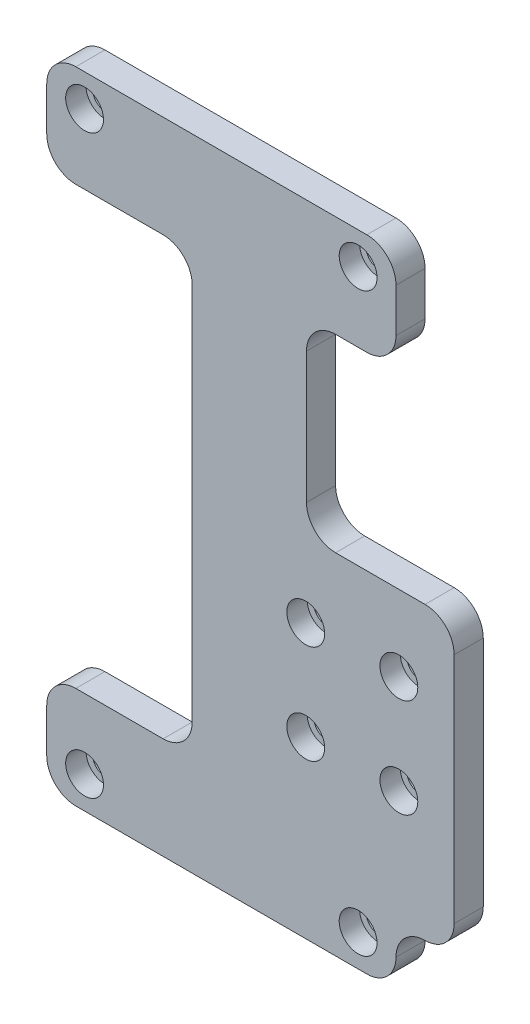
from build123d import *
from build123d.topology import SkipClean

# Parameters (mm, degrees)
BOSS_EXTRUDE1_DEPTH = 5
SKETCH3_R           = 2.1
CUT_EXTRUDE1_DEPTH  = 10
BOSS_EXTRUDE2_DEPTH = 5
SKETCH4_3_R         = 2.1
CUT_EXTRUDE2_DEPTH  = 5
FILLET1_R           = 5
SKETCH5_W           = 25
SKETCH5_H           = 75
SKETCH5_W_2         = 15.371996706
SKETCH5_H_2         = 32.5
CUT_EXTRUDE3_DEPTH  = 5
FILLET2_R           = 5
SKETCH6_R           = 3.25
CUT_EXTRUDE4_DEPTH  = 3.5


with BuildPart() as part:
    # Sketch1 → Boss-Extrude1 (new body)
    with BuildSketch(Plane.XY):
        Polygon((60, 40), (60, 110), (0, 110), (0, 0), (60, 0), align=None)
    extrude(amount=BOSS_EXTRUDE1_DEPTH)

    # Sketch3 → Cut-Extrude1 (cut)
    with BuildSketch(Plane.XY.offset(5)):
        with Locations((6.5, 5.5)):
            Circle(SKETCH3_R)
        with Locations((53.5, 5.5)):
            Circle(SKETCH3_R)
        with Locations(Location((53.5, 104.5, 0), (0, 0, 180))):
            Circle(SKETCH3_R)
        with Locations(Location((6.5, 104.5, 0), (0, 0, 180))):
            Circle(SKETCH3_R)
    extrude(amount=-CUT_EXTRUDE1_DEPTH, mode=Mode.SUBTRACT)

    # Sketch4 → Boss-Extrude2 (add)
    with BuildSketch(Plane.XY.offset(5)):
        with BuildLine():
            Line((70, 60), (60, 60))
            Line((60, 60), (60, 49.039607805))
            ThreePointArc((60, 49.039607805), (61.79614814, 48.652271164), (62.6, 47))
            ThreePointArc((62.6, 47), (61.79614814, 45.347728836), (60, 44.960392195))
            Line((60, 44.960392195), (60, 32.039607805))
            ThreePointArc((60, 32.039607805), (61.79614814, 31.652271164), (62.6, 30))
            ThreePointArc((62.6, 30), (61.79614814, 28.347728836), (60, 27.960392195))
            Line((60, 27.960392195), (60, 10))
            Line((60, 10), (70, 10))
            Line((70, 10), (70, 60))
        make_face()
    extrude(amount=-BOSS_EXTRUDE2_DEPTH)

    # Sketch4<3> → Cut-Extrude2 (cut)
    with SkipClean():  # the faces are left unmerged after this step: merging them gives an invalid solid
        with BuildSketch(Plane.XY.offset(5)):
            with Locations((60.5, 30)):
                Circle(SKETCH4_3_R)
            with Locations((44.5, 30)):
                Circle(SKETCH4_3_R)
            with Locations((44.5, 47)):
                Circle(SKETCH4_3_R)
            with Locations((60.5, 47)):
                Circle(SKETCH4_3_R)
        extrude(amount=-CUT_EXTRUDE2_DEPTH, mode=Mode.SUBTRACT)

    # Fillet1
    fillet1_edges = [part.edges().sort_by_distance(p)[0] for p in [
        (0, 110, 2.5),
        (0, 0, 2.5),
    ]]
    fillet(fillet1_edges, radius=FILLET1_R)

    # Sketch5 → Cut-Extrude3 (cut)
    with BuildSketch(Plane.XY.offset(5)):
        with Locations((12.5, 55)):
            Rectangle(SKETCH5_W, SKETCH5_H)
        with Locations((52.314001647, 76.25)):
            Rectangle(SKETCH5_W_2, SKETCH5_H_2)
    extrude(amount=-CUT_EXTRUDE3_DEPTH, mode=Mode.SUBTRACT)

    # Fillet2
    fillet2_edges = [part.edges().sort_by_distance(p)[0] for p in [
        (60, 0, 2.5),
        (60, 10, 2.5),
        (70, 10, 2.5),
        (70, 60, 2.5),
        (60, 92.5, 2.5),
        (60, 110, 2.5),
        (44.628003294, 92.5, 2.5),
        (44.628003294, 60, 2.5),
        (0, 17.5, 2.5),
        (25, 17.5, 2.5),
        (25, 92.5, 2.5),
        (0, 92.5, 2.5),
    ]]
    fillet(fillet2_edges, radius=FILLET2_R - 0.0001)  # a hair under: the kernel refuses the full size

    # Sketch6 → Cut-Extrude4 (cut)
    with BuildSketch(Plane.XY.offset(5)):
        with Locations((44.5, 47)):
            Circle(SKETCH6_R)
        with Locations((60.5, 47)):
            Circle(SKETCH6_R)
        with Locations((60.5, 30)):
            Circle(SKETCH6_R)
        with Locations((44.5, 30)):
            Circle(SKETCH6_R)
        with Locations((53.5, 5.5)):
            Circle(SKETCH6_R)
        with Locations((6.5, 5.5)):
            Circle(SKETCH6_R)
        with Locations((6.5, 104.5)):
            Circle(SKETCH6_R)
        with Locations((53.5, 104.5)):
            Circle(SKETCH6_R)
    extrude(amount=-CUT_EXTRUDE4_DEPTH, mode=Mode.SUBTRACT)


solid = part.part
